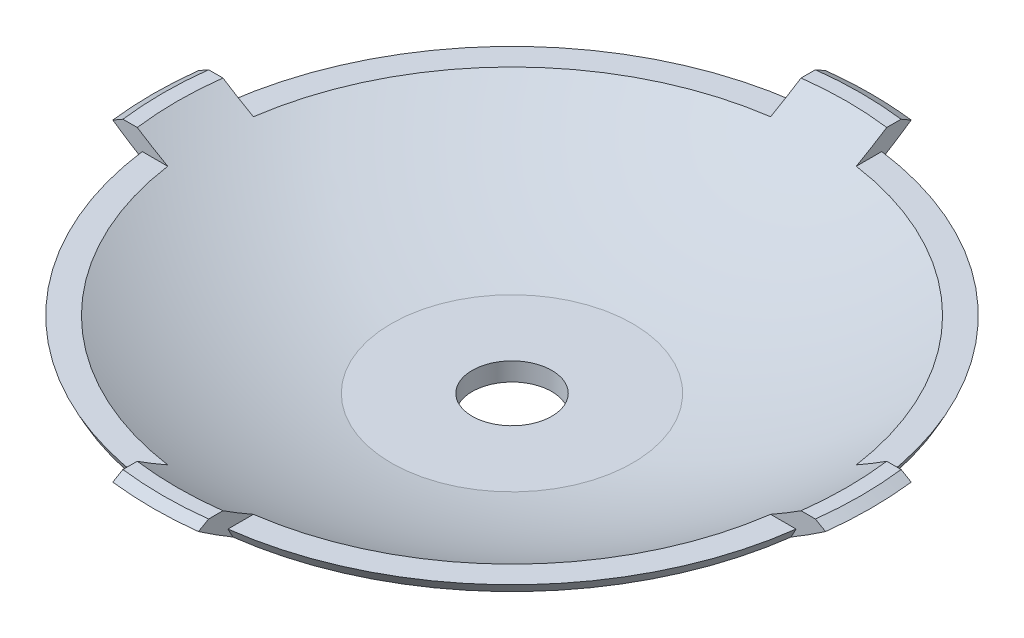
from build123d import *

# Parameters (mm, degrees)
SHELL1_T           = -3
CUT_EXTRUDE1_DEPTH = 3
CIRPATTERN1_COUNT  = 4
SKETCH3_R          = 6.5
CUT_EXTRUDE2_DEPTH = 3
CHAMFER1_SIZE      = 1.690983403
CHAMFER1_SIZE_2    = 3


with BuildPart() as part:
    # Sketch1 → Revolve1 (revolve)
    with BuildSketch(Plane.XY, mode=Mode.PRIVATE) as revolve1_sk:
        with BuildLine():
            Line((0, 0), (0, 17))
            Line((0, 17), (-60, 17))
            ThreePointArc((-60, 17), (-40.934750194, 6.300587778), (-20, 0))
            Line((-20, 0), (0, 0))
        make_face()
    revolve(revolve1_sk.sketch.rotate(Axis((0, 0, 0), (0, 1, 0)), 270), axis=Axis((0, 0, 0), (0, 1, 0)))

    # Shell1
    shell1_openings = [part.faces().sort_by_distance(p)[0] for p in [
        (0, 17, 0),
    ]]
    offset(amount=SHELL1_T, openings=shell1_openings, kind=Kind.INTERSECTION)

    # Sketch2 → Cut-Extrude1 (cut)
    with BuildSketch(Plane(origin=(0, 17, 0), x_dir=(1, 0, 0), z_dir=(0, 1, 0))):
        with BuildLine():
            Line((7, 59.590267662), (7, 7))
            Line((7, 7), (59.590267662, 7))
            ThreePointArc((59.590267662, 7), (42.426406871, 42.426406871), (7, 59.590267662))
        make_face()
    cut_extrude1 = extrude(amount=-CUT_EXTRUDE1_DEPTH, mode=Mode.SUBTRACT)

    # CirPattern1: Cut-Extrude1 ×4 about axis
    cirpattern1_axis = Axis((0, 0, 0), (0, 1, 0))
    for i in range(1, CIRPATTERN1_COUNT):
        add(cut_extrude1.rotate(cirpattern1_axis, i * 360 / CIRPATTERN1_COUNT), mode=Mode.SUBTRACT)

    # Sketch3 → Cut-Extrude2 (cut)
    with BuildSketch(Plane(origin=(0, 3, 0), x_dir=(1, 0, 0), z_dir=(0, 1, 0))):
        with Locations(Location((0, 0, 0), (0, 0, 270))):
            Circle(SKETCH3_R)
    extrude(amount=-CUT_EXTRUDE2_DEPTH, mode=Mode.SUBTRACT)

    # Chamfer1
    # the kernel refuses this chamfer: 3, 1.690983403, 1.647417444 mm, written as the material it takes off along each edge
    with BuildSketch(Plane(origin=(-9e-09, 14, 9e-09), x_dir=(-0.01004383631765335, 0, -0.9999495594038853), z_dir=(-0.9999495594038853, 0, 0.01004383631765335))) as chamfer1_piece_1_section:
        with BuildLine():
            Line((53.068743027, 1.536202574), (55.559224307 - CHAMFER1_SIZE, 0))
            Line((55.559224307 - CHAMFER1_SIZE, 0), (55.559224307, 0))
            ThreePointArc((55.559224307, 0), (54.27575816, 0.804240381), (53.068743027, 1.536202574))
        make_face()
    chamfer1_piece_1 = revolve(axis=Axis((-9e-09, 14, 9e-09), (0, -1, 0)), revolution_arc=91.150958214, mode=Mode.PRIVATE)
    chamfer1_piece_1 = split(chamfer1_piece_1, bisect_by=Plane(origin=(7, 14, 9e-09), z_dir=(1, 0, 0)), keep=Keep.TOP, mode=Mode.PRIVATE)
    chamfer1_piece_1 = split(chamfer1_piece_1, bisect_by=Plane(origin=(-9e-09, 14, -7), z_dir=(0, 0, -1)), keep=Keep.TOP, mode=Mode.PRIVATE)
    add(chamfer1_piece_1, mode=Mode.SUBTRACT)
    with BuildSketch(Plane(origin=(-9e-09, 14, -9e-09), x_dir=(0.9999495594038847, 0, -0.01004383631770428), z_dir=(-0.01004383631770428, 0, -0.9999495594038847))) as chamfer1_piece_2_section:
        with BuildLine():
            Line((53.068743027, 1.536202574), (55.559224307 - CHAMFER1_SIZE, 0))
            Line((55.559224307 - CHAMFER1_SIZE, 0), (55.559224307, 0))
            ThreePointArc((55.559224307, 0), (54.27575816, 0.804240381), (53.068743027, 1.536202574))
        make_face()
    chamfer1_piece_2 = revolve(axis=Axis((-9e-09, 14, -9e-09), (0, -1, 0)), revolution_arc=91.150958214, mode=Mode.PRIVATE)
    chamfer1_piece_2 = split(chamfer1_piece_2, bisect_by=Plane(origin=(-9e-09, 14, 7), z_dir=(0, 0, 1)), keep=Keep.TOP, mode=Mode.PRIVATE)
    chamfer1_piece_2 = split(chamfer1_piece_2, bisect_by=Plane(origin=(7, 14, -9e-09), z_dir=(1, 0, 0)), keep=Keep.TOP, mode=Mode.PRIVATE)
    add(chamfer1_piece_2, mode=Mode.SUBTRACT)
    with BuildSketch(Plane(origin=(9e-09, 14, 9e-09), x_dir=(-0.9999495594038847, 0, 0.010043836317696522), z_dir=(0.010043836317696522, 0, 0.9999495594038847))) as chamfer1_piece_3_section:
        with BuildLine():
            Line((53.068743027, 1.536202574), (55.559224307 - CHAMFER1_SIZE, 0))
            Line((55.559224307 - CHAMFER1_SIZE, 0), (55.559224307, 0))
            ThreePointArc((55.559224307, 0), (54.27575816, 0.804240381), (53.068743027, 1.536202574))
        make_face()
    chamfer1_piece_3 = revolve(axis=Axis((9e-09, 14, 9e-09), (0, -1, 0)), revolution_arc=91.150958214, mode=Mode.PRIVATE)
    chamfer1_piece_3 = split(chamfer1_piece_3, bisect_by=Plane(origin=(9e-09, 14, -7), z_dir=(0, 0, -1)), keep=Keep.TOP, mode=Mode.PRIVATE)
    chamfer1_piece_3 = split(chamfer1_piece_3, bisect_by=Plane(origin=(-7, 14, 9e-09), z_dir=(-1, 0, 0)), keep=Keep.TOP, mode=Mode.PRIVATE)
    add(chamfer1_piece_3, mode=Mode.SUBTRACT)
    with BuildSketch(Plane(origin=(9e-09, 14, -9e-09), x_dir=(0.010043836317723973, 0, 0.9999495594038845), z_dir=(0.9999495594038845, 0, -0.010043836317723973))) as chamfer1_piece_4_section:
        with BuildLine():
            Line((53.068743027, 1.536202574), (55.559224307 - CHAMFER1_SIZE, 0))
            Line((55.559224307 - CHAMFER1_SIZE, 0), (55.559224307, 0))
            ThreePointArc((55.559224307, 0), (54.27575816, 0.804240381), (53.068743027, 1.536202574))
        make_face()
    chamfer1_piece_4 = revolve(axis=Axis((9e-09, 14, -9e-09), (0, -1, 0)), revolution_arc=91.150958214, mode=Mode.PRIVATE)
    chamfer1_piece_4 = split(chamfer1_piece_4, bisect_by=Plane(origin=(-7, 14, -9e-09), z_dir=(-1, 0, 0)), keep=Keep.TOP, mode=Mode.PRIVATE)
    chamfer1_piece_4 = split(chamfer1_piece_4, bisect_by=Plane(origin=(9e-09, 14, 7), z_dir=(0, 0, 1)), keep=Keep.TOP, mode=Mode.PRIVATE)
    add(chamfer1_piece_4, mode=Mode.SUBTRACT)
    with BuildSketch(Plane(origin=(0, 17, 0), x_dir=(-0.969824010117872, 0, -0.24380604873318817), z_dir=(0.24380604873318817, 0, -0.969824010117872))) as chamfer1_piece_5:
        with BuildLine():
            Line((58.647089556, -0.950947599), (60 - CHAMFER1_SIZE_2, 0))
            Line((60 - CHAMFER1_SIZE_2, 0), (60, 0))
            ThreePointArc((60, 0), (59.346163268, -0.463749942), (58.647089556, -0.950947599))
        make_face()
    revolve(axis=Axis((0, 17, 0), (0, 1, 0)), revolution_arc=28.222571806, mode=Mode.SUBTRACT)
    with BuildSketch(Plane(origin=(0, 17, 0), x_dir=(0.24380521116314516, 0, -0.9698242206759399), z_dir=(0.9698242206759399, 0, 0.24380521116314516))) as chamfer1_piece_6:
        with BuildLine():
            Line((58.647089556, -0.950947599), (60 - CHAMFER1_SIZE_2, 0))
            Line((60 - CHAMFER1_SIZE_2, 0), (60, 0))
            ThreePointArc((60, 0), (59.346163268, -0.463749942), (58.647089556, -0.950947599))
        make_face()
    revolve(axis=Axis((0, 17, 0), (0, 1, 0)), revolution_arc=14.111236421, mode=Mode.SUBTRACT)
    with BuildSketch(Plane(origin=(0, 17, 0), x_dir=(0.9698240101178719, 0, 0.24380604873318873), z_dir=(-0.24380604873318873, 0, 0.9698240101178719))) as chamfer1_piece_7:
        with BuildLine():
            Line((58.647089556, -0.950947599), (60 - CHAMFER1_SIZE_2, 0))
            Line((60 - CHAMFER1_SIZE_2, 0), (60, 0))
            ThreePointArc((60, 0), (59.346163268, -0.463749942), (58.647089556, -0.950947599))
        make_face()
    revolve(axis=Axis((0, 17, 0), (0, 1, 0)), revolution_arc=28.222571806, mode=Mode.SUBTRACT)
    with BuildSketch(Plane(origin=(0, 17, 0), x_dir=(-0.24380604873318867, 0, 0.9698240101178719), z_dir=(-0.9698240101178719, 0, -0.24380604873318867))) as chamfer1_piece_8:
        with BuildLine():
            Line((58.647089556, -0.950947599), (60 - CHAMFER1_SIZE_2, 0))
            Line((60 - CHAMFER1_SIZE_2, 0), (60, 0))
            ThreePointArc((60, 0), (59.346163268, -0.463749942), (58.647089556, -0.950947599))
        make_face()
    revolve(axis=Axis((0, 17, 0), (0, 1, 0)), revolution_arc=28.222571806, mode=Mode.SUBTRACT)
    with BuildSketch(Plane(origin=(0, 17, 0), x_dir=(0, 0, -1), z_dir=(1, 0, 0))) as chamfer1_piece_9:
        with BuildLine():
            Line((58.647089556, -0.950947599), (60 - CHAMFER1_SIZE_2, 0))
            Line((60 - CHAMFER1_SIZE_2, 0), (60, 0))
            ThreePointArc((60, 0), (59.346163268, -0.463749942), (58.647089556, -0.950947599))
        make_face()
    revolve(axis=Axis((0, 17, 0), (0, 1, 0)), revolution_arc=14.111236421, mode=Mode.SUBTRACT)


solid = part.part
